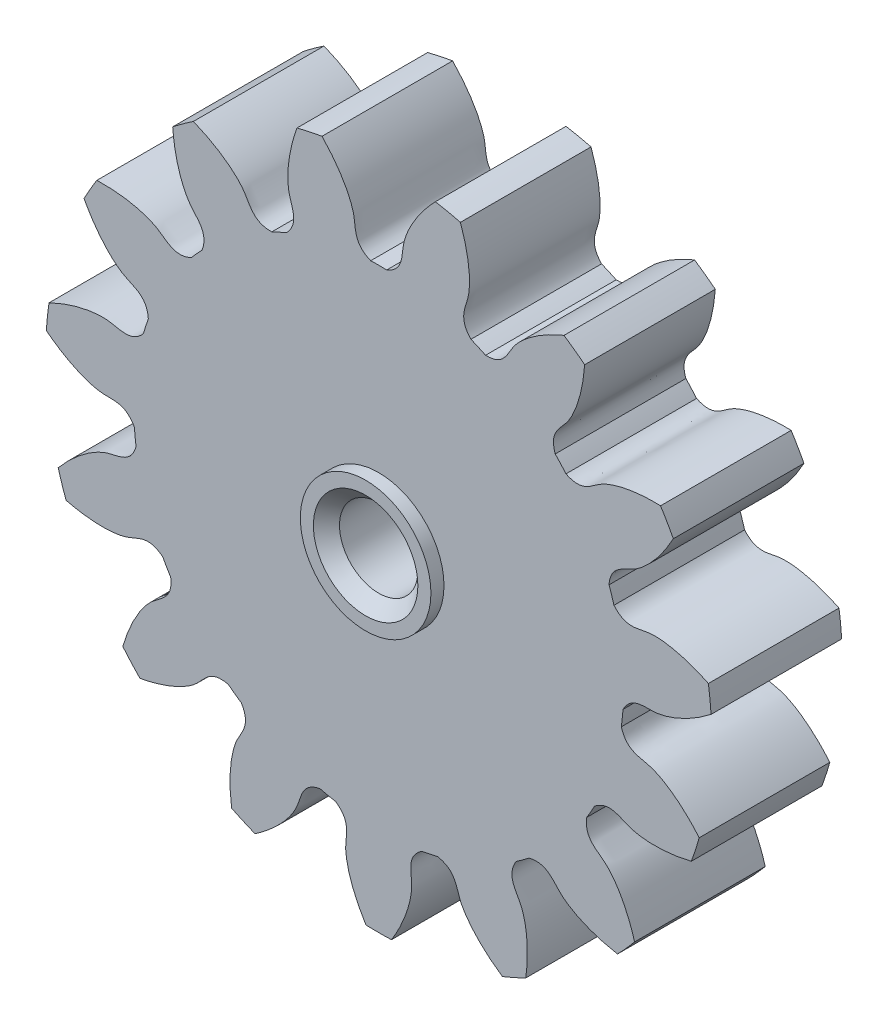
from build123d import *

# Parameters (mm, degrees)
SKETCH_1_R               = 12.75
EXTRUDE_1_DEPTH          = 5
CUT_EXTRUDE_1_DEPTH      = 19.711627401
PATTERN_CIRCULAR_1_COUNT = 15
SKETCH_4_R               = 1.5
CUT_EXTRUDE_2_DEPTH      = 19.69255157
EXTRUDE_START            = 0.5
SKETCH_5_R               = 2.5
SKETCH_5_R_2             = 1.5
EXTRUDE_2_DEPTH          = 0.5
CHAMFER_1_SIZE           = 0.5


with BuildPart() as part:
    # 草图1 → 凸台-拉伸1 (new body)
    with BuildSketch(Plane.XY):
        Circle(SKETCH_1_R)
    extrude(amount=EXTRUDE_1_DEPTH)

    # 草图2 → 切除-拉伸1 (cut, through all)
    with BuildSketch(Plane.XY):
        with BuildLine():
            ThreePointArc((0.306427562, 9.369990776), (0, 9.375), (-0.306427562, 9.369990776))
            add(Edge.make_bspline(
                [(-0.306427562, 9.369990776), (-0.985819588, 9.651615343), (-0.858169701, 10.179494134), (-0.97689073, 10.662755648), (-0.986149768, 10.697487444), (-0.997273271, 10.736090735), (-1.010415356, 10.778503957), (-1.025733602, 10.824659963), (-1.043382046, 10.874487146), (-1.063513204, 10.92790915), (-1.086277288, 10.984845026), (-1.111822276, 11.04520926), (-1.140293737, 11.10891184), (-1.171834724, 11.175858315), (-1.206585651, 11.245949863), (-1.244684177, 11.319083356), (-1.286265091, 11.395151435), (-1.331460195, 11.474042582), (-1.380398197, 11.555641197), (-1.433204596, 11.639827679), (-1.490001574, 11.726478508), (-1.550907895, 11.81546633), (-1.616038794, 11.906660045), (-1.685505881, 11.999924899), (-1.759417036, 12.095122575), (-1.837876316, 12.192111292), (-1.920983857, 12.290745898), (-2.008835785, 12.390877976), (-2.101524119, 12.492355945), (-2.199136692, 12.595025163), (-2.301757059, 12.698728038), (-2.409464417, 12.803304135), (-2.522333527, 12.90859029), (-2.640434633, 13.014420721), (-2.763833392, 13.120627146), (-2.8925908, 13.227038901), (-3.026763122, 13.333483058), (-3.166401833, 13.439784546), (-3.311553545, 13.545766275), (-3.462259959, 13.651249263), (-3.618557797, 13.756052756), (-3.78047876, 13.859994363), (-3.948049464, 13.962890179), (-4.121291414, 14.06455492), (-4.300220913, 14.164802055), (-4.548878493, 14.297653055), (-4.74022787, 14.392550949), (-4.870257583, 14.45389231)],
                knots=[0, 0, 0, 0, 0.202473101, 0.206978902, 0.212085478, 0.217792827, 0.224100949, 0.231009845, 0.238519514, 0.246629958, 0.255341174, 0.264653164, 0.274565928, 0.285079465, 0.296193776, 0.307908861, 0.320224719, 0.33314135, 0.346658755, 0.360776934, 0.375495886, 0.390815612, 0.406736111, 0.423257384, 0.440379431, 0.458102251, 0.476425844, 0.495350211, 0.514875352, 0.535001266, 0.555727954, 0.577055415, 0.59898365, 0.621512658, 0.64464244, 0.668372996, 0.692704325, 0.717636428, 0.743169304, 0.769302954, 0.796037377, 0.823372574, 0.851308544, 0.879845288, 0.908982806, 0.938721097, 1, 1, 1, 1], degree=3))
            ThreePointArc((-4.870257583, 14.45389231), (0, 15.252357583), (4.870257583, 14.45389231))
            add(Edge.make_bspline(
                [(0.306427562, 9.369990776), (0.985819588, 9.651615343), (0.858169701, 10.179494134), (0.97689073, 10.662755648), (0.986149768, 10.697487444), (0.997273271, 10.736090735), (1.010415356, 10.778503957), (1.025733602, 10.824659963), (1.043382046, 10.874487146), (1.063513204, 10.92790915), (1.086277288, 10.984845026), (1.111822276, 11.04520926), (1.140293737, 11.10891184), (1.171834724, 11.175858315), (1.206585651, 11.245949863), (1.244684177, 11.319083356), (1.286265091, 11.395151435), (1.331460195, 11.474042582), (1.380398197, 11.555641197), (1.433204596, 11.639827679), (1.490001574, 11.726478508), (1.550907895, 11.81546633), (1.616038794, 11.906660045), (1.685505881, 11.999924899), (1.759417036, 12.095122575), (1.837876316, 12.192111292), (1.920983857, 12.290745898), (2.008835785, 12.390877976), (2.101524119, 12.492355945), (2.199136692, 12.595025163), (2.301757059, 12.698728038), (2.409464417, 12.803304135), (2.522333527, 12.90859029), (2.640434633, 13.014420721), (2.763833392, 13.120627146), (2.8925908, 13.227038901), (3.026763122, 13.333483058), (3.166401833, 13.439784546), (3.311553545, 13.545766275), (3.462259959, 13.651249263), (3.618557797, 13.756052756), (3.78047876, 13.859994363), (3.948049464, 13.962890179), (4.121291414, 14.06455492), (4.300220913, 14.164802055), (4.548878493, 14.297653055), (4.74022787, 14.392550949), (4.870257583, 14.45389231)],
                knots=[0, 0, 0, 0, 0.202473101, 0.206978902, 0.212085478, 0.217792827, 0.224100949, 0.231009845, 0.238519514, 0.246629958, 0.255341174, 0.264653164, 0.274565928, 0.285079465, 0.296193776, 0.307908861, 0.320224719, 0.33314135, 0.346658755, 0.360776934, 0.375495886, 0.390815612, 0.406736111, 0.423257384, 0.440379431, 0.458102251, 0.476425844, 0.495350211, 0.514875352, 0.535001266, 0.555727954, 0.577055415, 0.59898365, 0.621512658, 0.64464244, 0.668372996, 0.692704325, 0.717636428, 0.743169304, 0.769302954, 0.796037377, 0.823372574, 0.851308544, 0.879845288, 0.908982806, 0.938721097, 1, 1, 1, 1], degree=3))
        make_face()
    cut_extrude_1 = extrude(amount=CUT_EXTRUDE_1_DEPTH, mode=Mode.SUBTRACT)

    # 阵列(圆周)1: 切除-拉伸1 ×15 about axis
    pattern_circular_1_axis = Axis((0, 0, -0.25), (0, 0, 1))
    for i in range(1, PATTERN_CIRCULAR_1_COUNT):
        add(cut_extrude_1.rotate(pattern_circular_1_axis, i * 360 / PATTERN_CIRCULAR_1_COUNT), mode=Mode.SUBTRACT)

    # 草图4 → 切除-拉伸2 (cut, through all)
    with BuildSketch(Plane.XY.offset(5)):
        Circle(SKETCH_4_R)
    extrude(amount=-CUT_EXTRUDE_2_DEPTH, mode=Mode.SUBTRACT)

    # 草图5 → 凸台-拉伸2 (add)
    with BuildSketch(Plane.XY.offset(5).offset(EXTRUDE_START)):
        Circle(SKETCH_5_R)
        Circle(SKETCH_5_R_2, mode=Mode.SUBTRACT)
    extrude(amount=-EXTRUDE_2_DEPTH)

    # 倒角1
    chamfer_1_edges = [part.edges().sort_by_distance(p)[0] for p in [
        (-1.5, 0, 0),
        (-1.5, 0, 5.5),
    ]]
    chamfer(chamfer_1_edges, length=CHAMFER_1_SIZE)


solid = part.part
